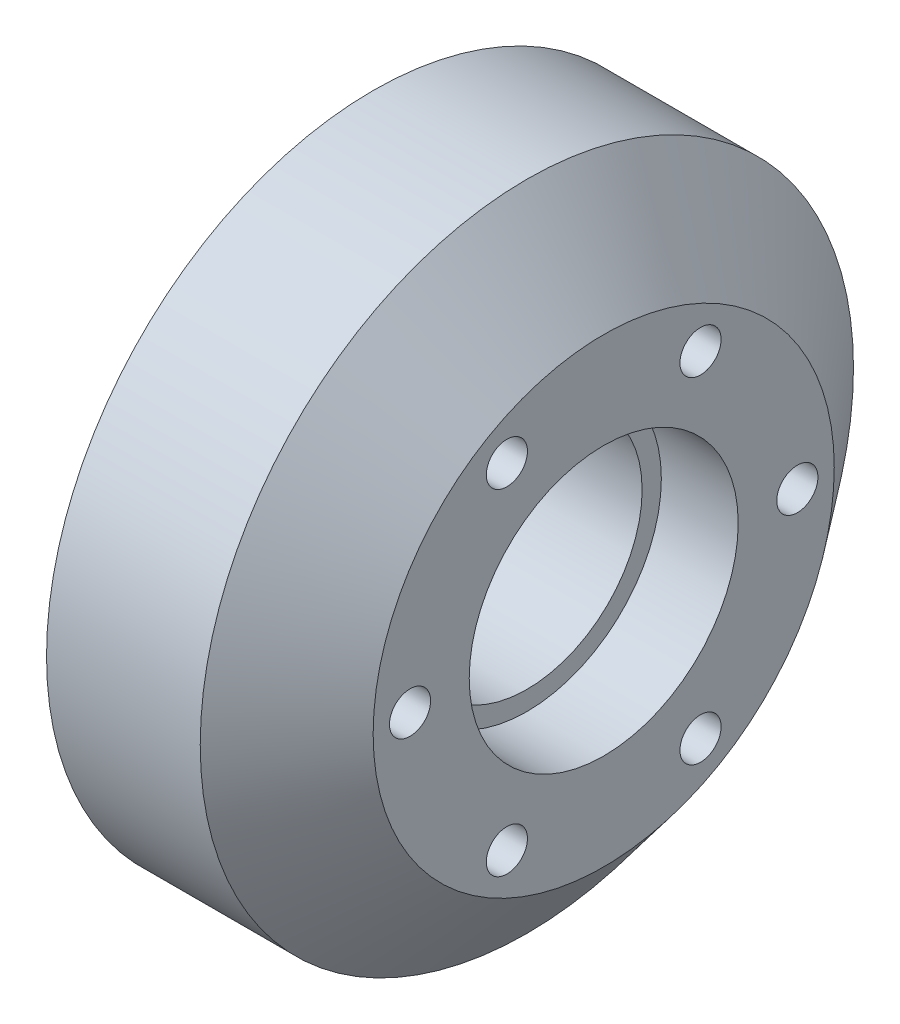
from build123d import *

# Parameters (mm, degrees)
CIRPATTERN1_COUNT = 6


with BuildPart() as part:
    # Sketch1 → Revolve1 (revolve)
    with BuildSketch(Plane.XY):
        Polygon((0, 26.9875), (0, 9.525), (12.7, 9.525), (12.7, 11.1125), (19.05, 11.1125), (19.05, 19.05), (12.7, 26.9875), align=None)
    revolve(axis=Axis((0, 0, 0), (-1, 0, 0)))

    # Sketch2 → Cut-Revolve1 (revolve, cut)
    with BuildSketch(Plane(origin=(0, 0, 0), x_dir=(1, 0, 0), z_dir=(0, 1, 0))):
        Polygon((19.05, 16), (0, 16), (0, 19.25), (12.7, 19.25), (12.7, 17.7), (19.05, 17.7), align=None)
    cut_revolve1 = revolve(axis=Axis((19.05, 0, -16), (1, 0, 0)), mode=Mode.SUBTRACT)

    # Sketch3 → Cut-Revolve2 (revolve, cut)
    with BuildSketch(Plane.XY):
        Polygon((0, 20.6375), (11.666564541, 20.6375), (9.525, 23.8125), (0, 23.8125), align=None)
    cut_revolve2 = revolve(axis=Axis((0, 20.6375, 0), (-1, 0, 0)), mode=Mode.SUBTRACT)

    # CirPattern1: Cut-Revolve1, Cut-Revolve2 ×6 about axis
    cirpattern1_axis = Axis((0, 0, 0), (1, 0, 0))
    add([cut_revolve1.rotate(cirpattern1_axis, i * 360 / CIRPATTERN1_COUNT) for i in range(1, CIRPATTERN1_COUNT)], mode=Mode.SUBTRACT)
    add([cut_revolve2.rotate(cirpattern1_axis, i * 360 / CIRPATTERN1_COUNT) for i in range(1, CIRPATTERN1_COUNT)], mode=Mode.SUBTRACT)


solid = part.part
